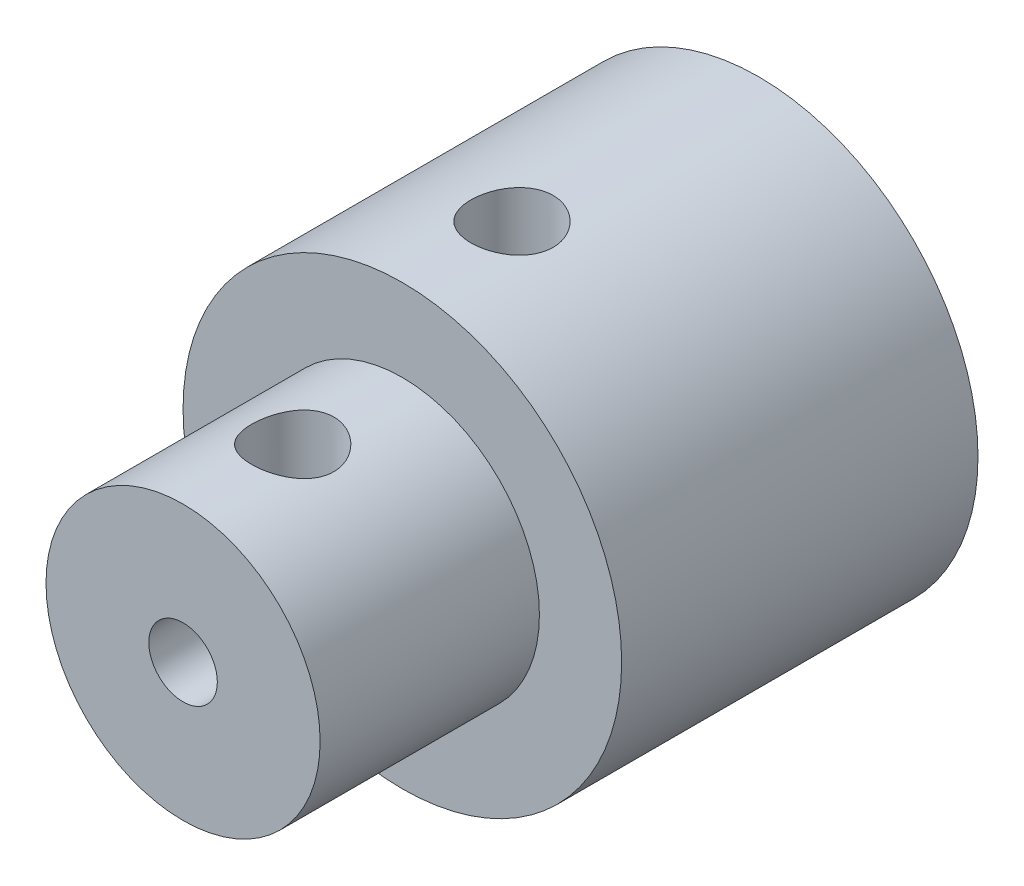
from build123d import *

# Parameters (mm, degrees)
CUT_EXTRUDE1_REACH             = 25.854
SKETCH2_R                      = 1.5
CUT_EXTRUDE1_DIRECTION_2_REACH = 25.854
SKETCH4_R                      = 1.25
CUT_EXTRUDE2_DEPTH             = 10


with BuildPart() as part:
    # Sketch1 → Revolve1 (revolve)
    with BuildSketch(Plane(origin=(0, 0, 0), x_dir=(0, 0, -1), z_dir=(1, 0, 0))):
        Polygon((0, 0), (0, 5), (8, 5), (8, 8), (21, 8), (21, 3.2), (10.5, 3.2), (8.577246019, 0), align=None)
    revolve(axis=Axis((0, 0, -8.577246019), (0, 0, 1)))

    # Sketch2 → Cut-Extrude1 (cut, up to next)
    with BuildSketch(Plane(origin=(0, 0, 0), x_dir=(1, 0, 0), z_dir=(0, 1, 0)), mode=Mode.PRIVATE) as cut_extrude1_sk1:
        with Locations((0, 12)):
            Circle(SKETCH2_R)
    cut_extrude1_tool1 = extrude(cut_extrude1_sk1.sketch, amount=-CUT_EXTRUDE1_REACH, mode=Mode.PRIVATE) & part.part
    # Sketch2 → Cut-Extrude1 (cut, up to next)
    with BuildSketch(Plane(origin=(0, 0, 0), x_dir=(1, 0, 0), z_dir=(0, 1, 0)), mode=Mode.PRIVATE) as cut_extrude1_sk2:
        with Locations((0, 4)):
            Circle(SKETCH2_R)
    cut_extrude1_tool2 = extrude(cut_extrude1_sk2.sketch, amount=-CUT_EXTRUDE1_REACH, mode=Mode.PRIVATE) & part.part
    add(cut_extrude1_tool1.solids().sort_by_distance((0, 0, -12))[0], mode=Mode.SUBTRACT)
    add(cut_extrude1_tool2.solids().sort_by_distance((0, 0, -4))[0], mode=Mode.SUBTRACT)

    # Sketch2 → Cut-Extrude1 direction 2 (cut, up to next)
    with BuildSketch(Plane(origin=(0, 0, 0), x_dir=(1, 0, 0), z_dir=(0, 1, 0)), mode=Mode.PRIVATE) as cut_extrude1_direction_2_sk1:
        with Locations((0, 12)):
            Circle(SKETCH2_R)
    cut_extrude1_direction_2_tool1 = extrude(cut_extrude1_direction_2_sk1.sketch, amount=CUT_EXTRUDE1_DIRECTION_2_REACH, mode=Mode.PRIVATE) & part.part
    # Sketch2 → Cut-Extrude1 direction 2 (cut, up to next)
    with BuildSketch(Plane(origin=(0, 0, 0), x_dir=(1, 0, 0), z_dir=(0, 1, 0)), mode=Mode.PRIVATE) as cut_extrude1_direction_2_sk2:
        with Locations((0, 4)):
            Circle(SKETCH2_R)
    cut_extrude1_direction_2_tool2 = extrude(cut_extrude1_direction_2_sk2.sketch, amount=CUT_EXTRUDE1_DIRECTION_2_REACH, mode=Mode.PRIVATE) & part.part
    add(cut_extrude1_direction_2_tool1.solids().sort_by_distance((0, 0, -12))[0], mode=Mode.SUBTRACT)
    add(cut_extrude1_direction_2_tool2.solids().sort_by_distance((0, 0, -4))[0], mode=Mode.SUBTRACT)

    # Sketch4 → Cut-Extrude2 (cut)
    with BuildSketch(Plane.XY):
        Circle(SKETCH4_R)
    extrude(amount=-CUT_EXTRUDE2_DEPTH, mode=Mode.SUBTRACT)


solid = part.part
